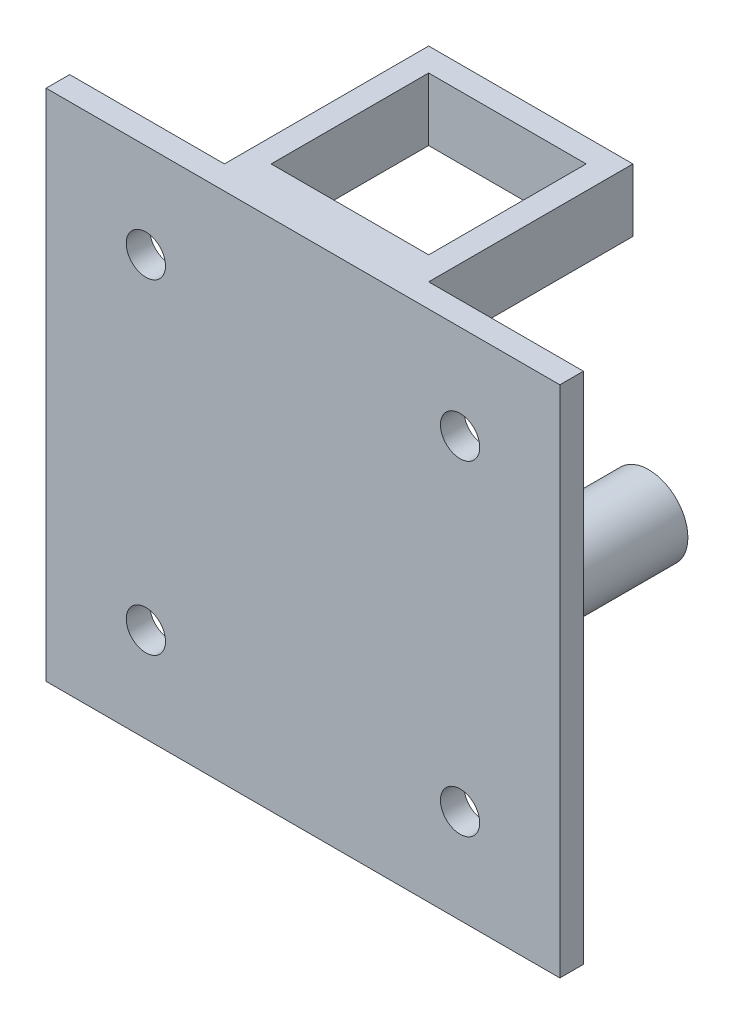
from build123d import *

# Parameters (mm, degrees)
SKETCH_1_W            = 65.4
SKETCH_1_H            = 65.4
SKETCH_1_R            = 2.5
EXTRUDE_463_DEPTH     = 3
SKETCH_2_W            = 26
SKETCH_2_H            = 8
EXTRUDE_698_DEPTH     = 26
SKETCH_3_W            = 20.05
SKETCH_3_H            = 20.05
CUT_EXTRUDE_905_DEPTH = 91.818059878
SKETCH_8_R            = 5.872551453
EXTRUDE_1_DEPTH       = 14.4
SKETCH_5_R            = 2.4
EXTRUDE_2_DEPTH       = 30
SKETCH_4_R            = 2
EXTRUDE_3_DEPTH       = 14.4
SKETCH_12_R           = 5
EXTRUDE_5_DEPTH       = 21
SKETCH_13_R           = 2
CUT_EXTRUDE_1_DEPTH   = 6.6


with BuildPart() as part:
    # Эскиз1 → Extrude 463 (new body)
    with BuildSketch(Plane.XY):
        with Locations((-32.7, 32.7)):
            Rectangle(SKETCH_1_W, SKETCH_1_H)
        with Locations((-52.7, 53.4)):
            Circle(SKETCH_1_R, mode=Mode.SUBTRACT)
        with Locations((-12.7, 53.4)):
            Circle(SKETCH_1_R, mode=Mode.SUBTRACT)
        with Locations((-12.7, 12)):
            Circle(SKETCH_1_R, mode=Mode.SUBTRACT)
        with Locations((-52.7, 12)):
            Circle(SKETCH_1_R, mode=Mode.SUBTRACT)
    extrude(amount=EXTRUDE_463_DEPTH)

    # Эскиз2 → Extrude 698 (add)
    with BuildSketch(Plane(origin=(0, 0, 0), x_dir=(-1, 0, 0), z_dir=(0, 0, -1))):
        with Locations((32.7, 61.4)):
            Rectangle(SKETCH_2_W, SKETCH_2_H)
    extrude(amount=EXTRUDE_698_DEPTH)

    # Эскиз3 → Cut-Extrude 905 (cut, through all)
    with BuildSketch(Plane.XZ.offset(-57.4)):
        with Locations((-32.7, -13)):
            Rectangle(SKETCH_3_W, SKETCH_3_H)
    extrude(amount=-CUT_EXTRUDE_905_DEPTH, mode=Mode.SUBTRACT)

    # Эскиз8 → Бобышка-Вытянуть1 (add)
    with BuildSketch(Plane(origin=(0, 0, 0), x_dir=(-1, 0, 0), z_dir=(0, 0, -1))):
        with Locations((52.7, 32.7)):
            Circle(SKETCH_8_R)
    extrude(amount=EXTRUDE_1_DEPTH)

    # Эскиз5 → Бобышка-Вытянуть2 (add)
    with BuildSketch(Plane(origin=(0, 0, 0), x_dir=(-1, 0, 0), z_dir=(0, 0, -1))):
        with Locations((52.7, 32.7)):
            Circle(SKETCH_5_R)
    extrude(amount=EXTRUDE_2_DEPTH)

    # Эскиз4 → Бобышка-Вытянуть3 (add)
    with BuildSketch(Plane(origin=(0, 0, 0), x_dir=(-1, 0, 0), z_dir=(0, 0, -1))):
        with Locations((12.7, 32.7)):
            Circle(SKETCH_4_R)
    extrude(amount=EXTRUDE_3_DEPTH)

    # Эскиз12 → Бобышка-Вытянуть5 (add)
    with BuildSketch(Plane(origin=(0, 0, 0), x_dir=(-1, 0, 0), z_dir=(0, 0, -1))):
        with Locations((12.7, 32.7)):
            Circle(SKETCH_12_R)
    extrude(amount=EXTRUDE_5_DEPTH)

    # Эскиз13 → Вырез-Вытянуть1 (cut)
    with BuildSketch(Plane(origin=(0, 0, -21), x_dir=(-1, 0, 0), z_dir=(0, 0, -1))):
        with Locations((12.7, 32.7)):
            Circle(SKETCH_13_R)
    extrude(amount=-CUT_EXTRUDE_1_DEPTH, mode=Mode.SUBTRACT)


solid = part.part
